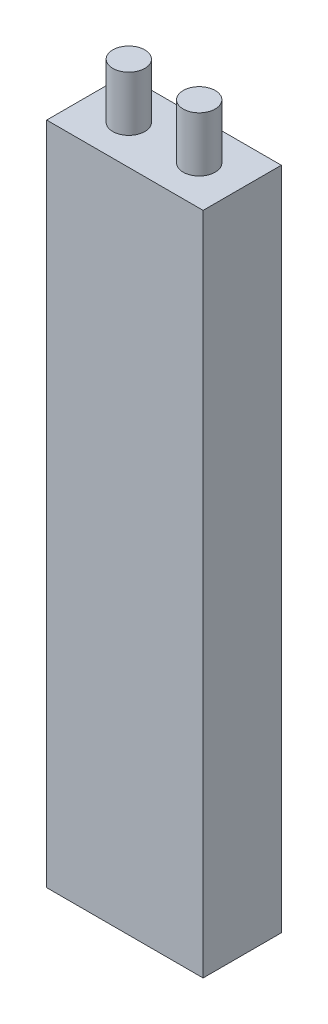
from build123d import *

# Parameters (mm, degrees)
SKETCH1_W           = 50.8
SKETCH1_H           = 25.4
BOSS_EXTRUDE1_DEPTH = 215.9
SKETCH2_R           = 5.207
BOSS_EXTRUDE2_DEPTH = 17.78
SKETCH3_R           = 5.207
CUT_EXTRUDE1_DEPTH  = 17.78


with BuildPart() as part:
    # Sketch1 → Boss-Extrude1 (new body)
    with BuildSketch(Plane(origin=(0, 0, 0), x_dir=(1, 0, 0), z_dir=(0, 1, 0))):
        with Locations((0, 12.7)):
            Rectangle(SKETCH1_W, SKETCH1_H)
    extrude(amount=BOSS_EXTRUDE1_DEPTH)

    # Sketch2 → Boss-Extrude2 (add)
    with BuildSketch(Plane(origin=(0, 215.9, 0), x_dir=(1, 0, 0), z_dir=(0, 1, 0))):
        with Locations((-11.43, 12.7)):
            Circle(SKETCH2_R)
        with Locations((11.43, 12.7)):
            Circle(SKETCH2_R)
    extrude(amount=BOSS_EXTRUDE2_DEPTH)

    # Sketch3 → Cut-Extrude1 (cut)
    with BuildSketch(Plane(origin=(0, 0, 0), x_dir=(-1, 0, 0), z_dir=(0, -1, 0))):
        with Locations((11.43, 12.7)):
            Circle(SKETCH3_R)
        with Locations((-11.43, 12.7)):
            Circle(SKETCH3_R)
    extrude(amount=-CUT_EXTRUDE1_DEPTH, mode=Mode.SUBTRACT)


solid = part.part
